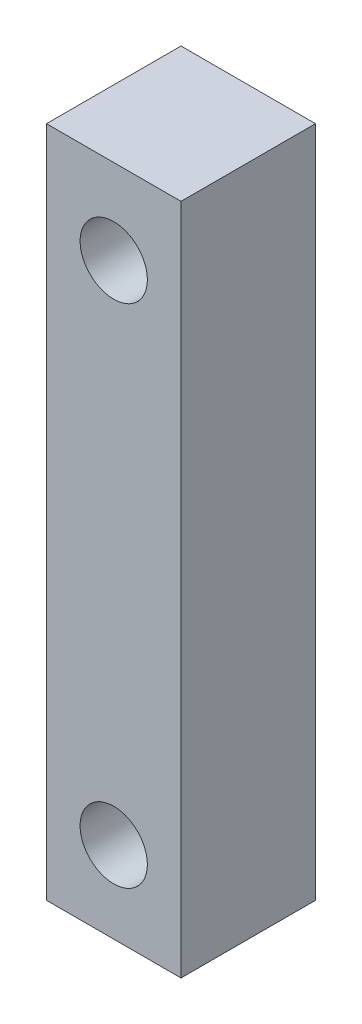
from build123d import *

# Parameters (mm, degrees)
SKETCH1_W           = 25.4
SKETCH1_H           = 25.4
BOSS_EXTRUDE1_DEPTH = 63.5
SKETCH2_R           = 6.35
CUT_EXTRUDE1_DEPTH  = 127


with BuildPart() as part:
    # Sketch1 → Boss-Extrude1 (new, symmetric)
    with BuildSketch(Plane(origin=(0, 0, 0), x_dir=(1, 0, 0), z_dir=(0, 1, 0))):
        Rectangle(SKETCH1_W, SKETCH1_H)
    extrude(amount=BOSS_EXTRUDE1_DEPTH, both=True)

    # Sketch2 → Cut-Extrude1 (cut)
    with BuildSketch(Plane.XY.offset(12.7)):
        with Locations((0, 47.488238195)):
            Circle(SKETCH2_R)
        with Locations((0, -48.111716158)):
            Circle(SKETCH2_R)
    extrude(amount=-CUT_EXTRUDE1_DEPTH, mode=Mode.SUBTRACT)


solid = part.part
